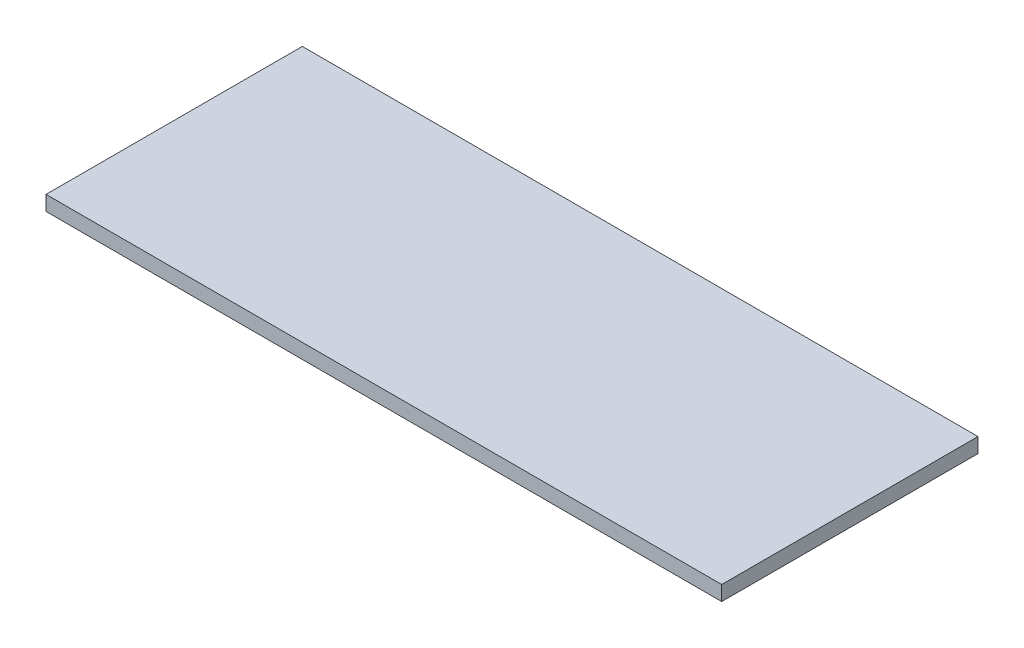
from build123d import *

# Parameters (mm, degrees)
SKETCH1_W           = 145
SKETCH1_H           = 55
BOSS_EXTRUDE1_DEPTH = 3.175


with BuildPart() as part:
    # Sketch1 → Boss-Extrude1 (new body)
    with BuildSketch(Plane(origin=(0, 0, 0), x_dir=(1, 0, 0), z_dir=(0, 1, 0))):
        with Locations((72.5, 27.5)):
            Rectangle(SKETCH1_W, SKETCH1_H)
    extrude(amount=BOSS_EXTRUDE1_DEPTH)


solid = part.part
